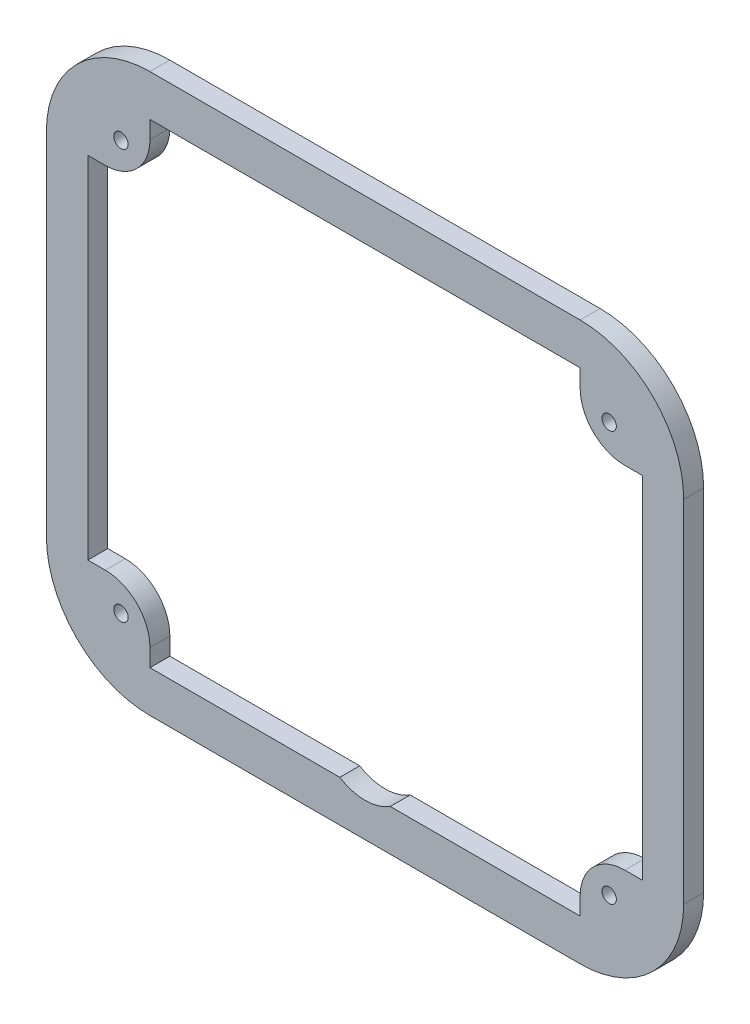
from build123d import *

# Parameters (mm, degrees)
SKETCH1_R           = 0.5715
BOSS_EXTRUDE1_DEPTH = 1.5875
FILLET1_R           = 3.556


with BuildPart() as part:
    # Sketch1 → Boss-Extrude1 (new body)
    with BuildSketch(Plane.XY):
        with BuildLine():
            Line((17.145, 22.225), (-17.145, 22.225))
            ThreePointArc((-17.145, 22.225), (-22.982166479, 19.807166479), (-25.4, 13.97))
            Line((-25.4, 13.97), (-25.4, -13.97))
            ThreePointArc((-25.4, -13.97), (-22.982166479, -19.807166479), (-17.145, -22.225))
            Line((-17.145, -22.225), (17.145, -22.225))
            ThreePointArc((17.145, -22.225), (22.982166479, -19.807166479), (25.4, -13.97))
            Line((25.4, -13.97), (25.4, 13.97))
            ThreePointArc((25.4, 13.97), (22.982166479, 19.807166479), (17.145, 22.225))
        make_face()
        with Locations((-19.457528855, 16.326805286)):
            Circle(SKETCH1_R, mode=Mode.SUBTRACT)
        with Locations((19.457528855, 16.326805286)):
            Circle(SKETCH1_R, mode=Mode.SUBTRACT)
        with Locations((19.457528855, -16.326805286)):
            Circle(SKETCH1_R, mode=Mode.SUBTRACT)
        with Locations((-19.457528855, -16.326805286)):
            Circle(SKETCH1_R, mode=Mode.SUBTRACT)
        with BuildLine():
            Line((-17.145, -18.923), (-2.01269959, -18.923))
            ThreePointArc((-2.01269959, -18.923), (0, -19.5072), (2.01269959, -18.923))
            Line((2.01269959, -18.923), (17.145, -18.923))
            Line((17.145, -18.923), (17.145, -13.97))
            Line((17.145, -13.97), (22.098, -13.97))
            Line((22.098, -13.97), (22.098, 13.97))
            Line((22.098, 13.97), (17.145, 13.97))
            Line((17.145, 13.97), (17.145, 18.923))
            Line((17.145, 18.923), (-17.145, 18.923))
            Line((-17.145, 18.923), (-17.145, 13.97))
            Line((-17.145, 13.97), (-22.098, 13.97))
            Line((-22.098, 13.97), (-22.098, -13.97))
            Line((-22.098, -13.97), (-17.145, -13.97))
            Line((-17.145, -13.97), (-17.145, -18.923))
        make_face(mode=Mode.SUBTRACT)
    extrude(amount=BOSS_EXTRUDE1_DEPTH)

    # Fillet1
    fillet1_edges = [part.edges().sort_by_distance(p)[0] for p in [
        (17.145, -13.97, 0.79375),
        (17.145, 13.97, 0.79375),
        (-17.145, -13.97, 0.79375),
        (-17.145, 13.97, 0.79375),
    ]]
    fillet(fillet1_edges, radius=FILLET1_R)


solid = part.part
